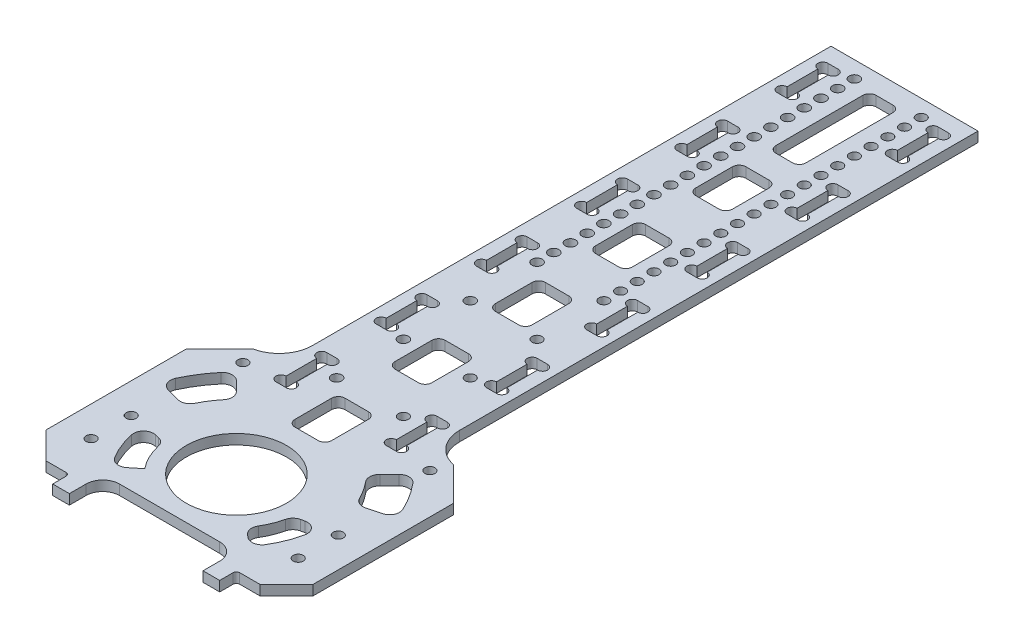
from build123d import *

# Parameters (mm, degrees)
EXTRUDE_1_DEPTH      = 3
SKETCH_2_W           = 18
SKETCH_2_H           = 165
CUT_EXTRUDE_1_DEPTH  = 127.29928273
CHAMFER_1_SIZE       = 10
FILLET_1_R           = 10
SKETCH_3_W           = 3.1
SKETCH_3_H           = 15.2
CUT_EXTRUDE_2_DEPTH  = 127.29928273
SKETCH_4_R           = 1.5
SKETCH_4_R_2         = 1.55
CUT_EXTRUDE_3_DEPTH  = 127.29928273
SKETCH_5_W           = 11
SKETCH_5_H           = 15
SKETCH_5_W_2         = 9
SKETCH_5_H_2         = 30
CUT_EXTRUDE_4_DEPTH  = 3
FILLET_2_R           = 2
SKETCH_6_R           = 15
CUT_EXTRUDE_5_DEPTH  = 3
CUT_EXTRUDE_6_DEPTH  = 127.29928273
FILLET_3_R           = 3
SKETCH_8_R           = 1.5
CUT_EXTRUDE_7_DEPTH  = 127.29928273
SKETCH_9_R           = 1.5
CUT_EXTRUDE_8_DEPTH  = 45
SKETCH_10_W          = 40
SKETCH_10_H          = 20
CUT_EXTRUDE_9_DEPTH  = 127.29928273
FILLET_4_R           = 5
FILLET_5_R           = 3
CHAMFER_2_SIZE       = 8
SKETCH_11_R          = 1.5
CUT_EXTRUDE_10_DEPTH = 10
FILLET_6_R           = 1


with BuildPart() as part:
    # 草图1 → 凸台-拉伸1 (new body)
    with BuildSketch(Plane(origin=(0, 0, 0), x_dir=(1, 0, 0), z_dir=(0, 1, 0))):
        Polygon((-20.072182136, -107), (-35.072182136, -107), (-35.072182136, 118), (44.927817864, 118), (44.927817864, -107), (29.927817864, -107), (29.927817864, -112), (-20.072182136, -112), align=None)
    extrude(amount=EXTRUDE_1_DEPTH)

    # 草图2 → 切除-拉伸1 (cut, through all)
    with BuildSketch(Plane(origin=(0, 3, 0), x_dir=(1, 0, 0), z_dir=(0, 1, 0))):
        with Locations((-26.072182136, 35.5)):
            Rectangle(SKETCH_2_W, SKETCH_2_H)
        with Locations((35.927817864, 35.5)):
            Rectangle(SKETCH_2_W, SKETCH_2_H)
    extrude(amount=-CUT_EXTRUDE_1_DEPTH, mode=Mode.SUBTRACT)

    # 倒角1
    chamfer_1_edges = [part.edges().sort_by_distance(p)[0] for p in [
        (-35.072182136, 1.5, 47),
        (44.927817864, 1.5, 47),
    ]]
    chamfer(chamfer_1_edges, length=CHAMFER_1_SIZE)

    # 圆角1
    # the kernel refuses this fillet: 10 mm, written as the material it adds along each edge
    with BuildSketch(Plane(origin=(-17.072182136, 3, 47), x_dir=(0, 0, -1), z_dir=(0, -1, 0))) as fillet_1_piece_1:
        with BuildLine():
            CenterArc((9.797958971, -10), FILLET_1_R, 90, 78.463040967)
            Line((0, -8), (-0.195959179, -7.96))
            ThreePointArc((-0.195959179, -7.96), (-0.2, -4), (-0.2, 0))
            Line((-0.2, 0), (0, 0.2))
            Line((0, 0.2), (9.797958971, 0.2))
            Line((9.797958971, 0.2), (9.797958971, 0))
        make_face()
    extrude(amount=3)
    with BuildSketch(Plane(origin=(26.927817864, 3, 47), x_dir=(1, 0, 0), z_dir=(0, -1, 0))) as fillet_1_piece_2:
        with BuildLine():
            CenterArc((10, -9.797958971), FILLET_1_R, 101.536959033, 78.463040967)
            Line((0, -9.797958971), (-0.2, -9.797958971))
            Line((-0.2, -9.797958971), (-0.2, 0))
            Line((-0.2, 0), (0, 0.2))
            ThreePointArc((0, 0.2), (4, 0.2), (7.96, 0.195959179))
            Line((7.96, 0.195959179), (8, 0))
        make_face()
    extrude(amount=3)

    # 草图3 → 切除-拉伸2 (cut, through all)
    with BuildSketch(Plane.XZ):
        with Locations((-11.572182136, -105.5)):
            Rectangle(SKETCH_3_W, SKETCH_3_H)
        with Locations((21.427817864, -105.5)):
            Rectangle(SKETCH_3_W, SKETCH_3_H)
        with Locations((-11.572182136, -75.5)):
            Rectangle(SKETCH_3_W, SKETCH_3_H)
        with Locations((21.427817864, -75.5)):
            Rectangle(SKETCH_3_W, SKETCH_3_H)
        with Locations((-11.572182136, -45.5)):
            Rectangle(SKETCH_3_W, SKETCH_3_H)
        with Locations((21.427817864, -45.5)):
            Rectangle(SKETCH_3_W, SKETCH_3_H)
        with Locations((-11.572182136, -15.5)):
            Rectangle(SKETCH_3_W, SKETCH_3_H)
        with Locations((21.427817864, -15.5)):
            Rectangle(SKETCH_3_W, SKETCH_3_H)
        with Locations((-11.572182136, 14.5)):
            Rectangle(SKETCH_3_W, SKETCH_3_H)
        with Locations((21.427817864, 14.5)):
            Rectangle(SKETCH_3_W, SKETCH_3_H)
        with Locations((-11.572182136, 44.5)):
            Rectangle(SKETCH_3_W, SKETCH_3_H)
        with Locations((21.427817864, 44.5)):
            Rectangle(SKETCH_3_W, SKETCH_3_H)
    extrude(amount=-CUT_EXTRUDE_2_DEPTH, mode=Mode.SUBTRACT)

    # 草图4 → 切除-拉伸3 (cut, through all)
    with BuildSketch(Plane(origin=(0, 3, 0), x_dir=(1, 0, 0), z_dir=(0, 1, 0))):
        with Locations(Location((14.927817864, 113, 0), (0, 0, 270))):
            Circle(SKETCH_4_R)
        with Locations(Location((-5.072182136, 113, 0), (0, 0, 90))):
            Circle(SKETCH_4_R_2)
        with Locations(Location((-5.072182136, 108, 0), (0, 0, 90))):
            Circle(SKETCH_4_R_2)
        with Locations(Location((14.927817864, 108, 0), (0, 0, 270))):
            Circle(SKETCH_4_R)
        with Locations(Location((-5.072182136, 103, 0), (0, 0, 90))):
            Circle(SKETCH_4_R_2)
        with Locations(Location((14.927817864, 103, 0), (0, 0, 270))):
            Circle(SKETCH_4_R)
        with Locations(Location((-5.072182136, 98, 0), (0, 0, 90))):
            Circle(SKETCH_4_R_2)
        with Locations(Location((14.927817864, 98, 0), (0, 0, 270))):
            Circle(SKETCH_4_R)
        with Locations(Location((-5.072182136, 93, 0), (0, 0, 90))):
            Circle(SKETCH_4_R_2)
        with Locations(Location((14.927817864, 93, 0), (0, 0, 270))):
            Circle(SKETCH_4_R)
        with Locations(Location((-5.072182136, 88, 0), (0, 0, 90))):
            Circle(SKETCH_4_R_2)
        with Locations(Location((14.927817864, 88, 0), (0, 0, 270))):
            Circle(SKETCH_4_R)
        with Locations(Location((-5.072182136, 83, 0), (0, 0, 90))):
            Circle(SKETCH_4_R_2)
        with Locations(Location((14.927817864, 83, 0), (0, 0, 270))):
            Circle(SKETCH_4_R)
        with Locations(Location((-5.072182136, 78, 0), (0, 0, 90))):
            Circle(SKETCH_4_R_2)
        with Locations(Location((14.927817864, 78, 0), (0, 0, 270))):
            Circle(SKETCH_4_R)
        with Locations(Location((-5.072182136, 73, 0), (0, 0, 90))):
            Circle(SKETCH_4_R_2)
        with Locations(Location((14.927817864, 73, 0), (0, 0, 270))):
            Circle(SKETCH_4_R)
        with Locations(Location((-5.072182136, 68, 0), (0, 0, 90))):
            Circle(SKETCH_4_R_2)
        with Locations(Location((14.927817864, 68, 0), (0, 0, 270))):
            Circle(SKETCH_4_R)
        with Locations(Location((-5.072182136, 63, 0), (0, 0, 90))):
            Circle(SKETCH_4_R_2)
        with Locations(Location((14.927817864, 63, 0), (0, 0, 270))):
            Circle(SKETCH_4_R)
        with Locations(Location((-5.072182136, 58, 0), (0, 0, 90))):
            Circle(SKETCH_4_R_2)
        with Locations(Location((14.927817864, 58, 0), (0, 0, 270))):
            Circle(SKETCH_4_R)
        with Locations(Location((-5.072182136, 53, 0), (0, 0, 90))):
            Circle(SKETCH_4_R_2)
        with Locations(Location((14.927817864, 53, 0), (0, 0, 270))):
            Circle(SKETCH_4_R)
        with Locations(Location((-5.072182136, 48, 0), (0, 0, 90))):
            Circle(SKETCH_4_R_2)
        with Locations(Location((14.927817864, 48, 0), (0, 0, 270))):
            Circle(SKETCH_4_R)
        with Locations(Location((-5.072182136, 43, 0), (0, 0, 90))):
            Circle(SKETCH_4_R_2)
        with Locations(Location((14.927817864, 43, 0), (0, 0, 270))):
            Circle(SKETCH_4_R)
        with Locations(Location((-5.072182136, 38, 0), (0, 0, 90))):
            Circle(SKETCH_4_R_2)
        with Locations(Location((14.927817864, 38, 0), (0, 0, 270))):
            Circle(SKETCH_4_R)
        with Locations(Location((-5.072182136, 33, 0), (0, 0, 90))):
            Circle(SKETCH_4_R_2)
        with Locations(Location((14.927817864, 33, 0), (0, 0, 270))):
            Circle(SKETCH_4_R)
        with Locations(Location((-5.072182136, 28, 0), (0, 0, 90))):
            Circle(SKETCH_4_R_2)
        with Locations(Location((14.927817864, 28, 0), (0, 0, 270))):
            Circle(SKETCH_4_R)
        with Locations(Location((-5.072182136, 23, 0), (0, 0, 90))):
            Circle(SKETCH_4_R_2)
        with Locations(Location((14.927817864, 23, 0), (0, 0, 270))):
            Circle(SKETCH_4_R)
        with Locations(Location((-5.072182136, 18, 0), (0, 0, 90))):
            Circle(SKETCH_4_R_2)
        with Locations(Location((14.927817864, 18, 0), (0, 0, 270))):
            Circle(SKETCH_4_R)
        with Locations(Location((-5.072182136, -2, 0), (0, 0, 90))):
            Circle(SKETCH_4_R_2)
        with Locations(Location((14.927817864, -2, 0), (0, 0, 270))):
            Circle(SKETCH_4_R)
        with Locations(Location((-5.072182136, -22, 0), (0, 0, 90))):
            Circle(SKETCH_4_R_2)
        with Locations(Location((14.927817864, -22, 0), (0, 0, 270))):
            Circle(SKETCH_4_R)
        with Locations(Location((-5.072182136, -42, 0), (0, 0, 90))):
            Circle(SKETCH_4_R_2)
        with Locations(Location((14.927817864, -42, 0), (0, 0, 270))):
            Circle(SKETCH_4_R)
        with Locations(Location((-23.072182136, -52.071067812, 0), (0, 0, 270))):
            Circle(SKETCH_4_R)
        with Locations(Location((32.927817864, -52.071067812, 0), (0, 0, 270))):
            Circle(SKETCH_4_R)
    extrude(amount=-CUT_EXTRUDE_3_DEPTH, mode=Mode.SUBTRACT)

    # 草图5 → 切除-拉伸4 (cut)
    with BuildSketch(Plane.XZ):
        with Locations((4.927817864, -36.5)):
            Rectangle(SKETCH_5_W, SKETCH_5_H)
        with Locations((4.927817864, -97)):
            Rectangle(SKETCH_5_W_2, SKETCH_5_H_2)
        with Locations((4.927817864, -66.5)):
            Rectangle(SKETCH_5_W, SKETCH_5_H)
        with Locations((4.927817864, -6.5)):
            Rectangle(SKETCH_5_W, SKETCH_5_H)
        with Locations((4.927817864, 23.5)):
            Rectangle(SKETCH_5_W, SKETCH_5_H)
        with Locations((4.927817864, 53.5)):
            Rectangle(SKETCH_5_W, SKETCH_5_H)
    extrude(amount=-CUT_EXTRUDE_4_DEPTH, mode=Mode.SUBTRACT)

    # 圆角2
    fillet_2_edges = [part.edges().sort_by_distance(p)[0] for p in [
        (0.427817864, 1.5, -112),
        (0.427817864, 1.5, -82),
        (9.427817864, 1.5, -82),
        (9.427817864, 1.5, -112),
        (-0.572182136, 1.5, -74),
        (-0.572182136, 1.5, -59),
        (10.427817864, 1.5, -59),
        (10.427817864, 1.5, -74),
        (10.427817864, 1.5, -44),
        (-0.572182136, 1.5, -44),
        (-0.572182136, 1.5, -29),
        (10.427817864, 1.5, -29),
        (10.427817864, 1.5, -14),
        (-0.572182136, 1.5, -14),
        (-0.572182136, 1.5, 1),
        (10.427817864, 1.5, 1),
        (10.427817864, 1.5, 16),
        (-0.572182136, 1.5, 16),
        (-0.572182136, 1.5, 31),
        (10.427817864, 1.5, 31),
        (10.427817864, 1.5, 46),
        (-0.572182136, 1.5, 46),
        (-0.572182136, 1.5, 61),
        (10.427817864, 1.5, 61),
    ]]
    fillet(fillet_2_edges, radius=FILLET_2_R)

    # 草图6 → 切除-拉伸5 (cut)
    with BuildSketch(Plane.XZ):
        with Locations(Location((4.927817864, 82, 0), (0, 0, 270))):
            Circle(SKETCH_6_R)
    extrude(amount=-CUT_EXTRUDE_5_DEPTH, mode=Mode.SUBTRACT)

    # 草图7 → 切除-拉伸6 (cut, through all)
    with BuildSketch(Plane(origin=(0, 3, 0), x_dir=(1, 0, 0), z_dir=(0, 1, 0))):
        with BuildLine():
            Line((24.373254346, -62.554563517), (31.444322158, -55.483495706))
            ThreePointArc((31.444322158, -55.483495706), (36.634268405, -61.976239262), (40.266427168, -69.452781487))
            Line((40.266427168, -69.452781487), (30.565487248, -72.052140504))
            ThreePointArc((30.565487248, -72.052140504), (27.964150055, -66.980765692), (24.373254346, -62.554563517))
        make_face()
        with BuildLine():
            Line((-14.517618619, -62.554563517), (-21.588686431, -55.483495706))
            ThreePointArc((-21.588686431, -55.483495706), (-26.778632677, -61.976239262), (-30.410791441, -69.452781487))
            Line((-30.410791441, -69.452781487), (-20.709851521, -72.052140504))
            ThreePointArc((-20.709851521, -72.052140504), (-18.108514327, -66.980765692), (-14.517618619, -62.554563517))
        make_face()
    extrude(amount=-CUT_EXTRUDE_6_DEPTH, mode=Mode.SUBTRACT)

    # 圆角3
    fillet_3_edges = [part.edges().sort_by_distance(p)[0] for p in [
        (31.444322158, 1.5, 55.483495706),
        (40.266427168, 1.5, 69.452781487),
        (30.565487248, 1.5, 72.052140504),
        (24.373254346, 1.5, 62.554563517),
        (-14.517618619, 1.5, 62.554563517),
        (-20.709851521, 1.5, 72.052140504),
        (-30.410791441, 1.5, 69.452781487),
        (-21.588686431, 1.5, 55.483495706),
    ]]
    fillet(fillet_3_edges, radius=FILLET_3_R)

    # 草图8 → 切除-拉伸7 (cut, through all)
    with BuildSketch(Plane(origin=(0, 3, 0), x_dir=(1, 0, 0), z_dir=(0, 1, 0))):
        with Locations(Location((-26.072182136, -94.5, 0), (0, 0, 270))):
            Circle(SKETCH_8_R)
        with Locations(Location((35.927817864, -94.5, 0), (0, 0, 90))):
            Circle(SKETCH_8_R)
    extrude(amount=-CUT_EXTRUDE_7_DEPTH, mode=Mode.SUBTRACT)

    # 草图9 → 切除-拉伸8 (cut, symmetric)
    with BuildSketch(Plane(origin=(-54.354252305, 3, 108.5), x_dir=(-1, 0, 0), z_dir=(0, -1, 0))):
        with Locations(Location((-90.282070169, 26, 0), (0, 0, 180))):
            Circle(SKETCH_9_R)
        with Locations(Location((-28.282070169, 26, 0), (0, 0, 180))):
            Circle(SKETCH_9_R)
    extrude(amount=CUT_EXTRUDE_8_DEPTH, both=True, mode=Mode.SUBTRACT)

    # 草图10 → 切除-拉伸9 (cut, through all)
    with BuildSketch(Plane.XZ):
        with Locations((4.927817864, 112)):
            Rectangle(SKETCH_10_W, SKETCH_10_H)
        with BuildLine():
            Line((20.095386546, 94.255401269), (25.540154791, 98.654776084))
            ThreePointArc((25.540154791, 98.654776084), (29.745634898, 91.291176333), (31.409831884, 82.976183092))
            Line((31.409831884, 82.976183092), (24.265490182, 84.510862268))
            ThreePointArc((24.265490182, 84.510862268), (22.855224932, 89.671901706), (20.095386546, 94.255401269))
        make_face()
        with BuildLine():
            Line((-14.409854454, 84.510862268), (-21.554196157, 82.976183092))
            ThreePointArc((-21.554196157, 82.976183092), (-19.889999171, 91.291176333), (-15.684519064, 98.654776084))
            Line((-15.684519064, 98.654776084), (-10.239750819, 94.255401269))
            ThreePointArc((-10.239750819, 94.255401269), (-12.999589205, 89.671901706), (-14.409854454, 84.510862268))
        make_face()
    extrude(amount=-CUT_EXTRUDE_9_DEPTH, mode=Mode.SUBTRACT)

    # 圆角4
    fillet_4_edges = [part.edges().sort_by_distance(p)[0] for p in [
        (-15.072182136, 1.5, 102),
        (24.927817864, 1.5, 102),
    ]]
    fillet(fillet_4_edges, radius=FILLET_4_R)

    # 圆角5
    fillet_5_edges = [part.edges().sort_by_distance(p)[0] for p in [
        (25.540154791, 1.5, 98.654776084),
        (31.409831884, 1.5, 82.976183092),
        (24.265490182, 1.5, 84.510862268),
        (20.095386546, 1.5, 94.255401269),
        (-14.409854454, 1.5, 84.510862268),
        (-21.554196157, 1.5, 82.976183092),
        (-15.684519064, 1.5, 98.654776084),
    ]]
    fillet(fillet_5_edges, radius=FILLET_5_R)

    # 倒角2
    chamfer_2_edges = [part.edges().sort_by_distance(p)[0] for p in [
        (-35.072182136, 1.5, 107),
        (44.927817864, 1.5, 107),
    ]]
    chamfer(chamfer_2_edges, length=CHAMFER_2_SIZE)

    # 草图11 → 切除-拉伸10 (cut)
    with BuildSketch(Plane.XZ):
        with Locations((22.977817864, -111.6)):
            Circle(SKETCH_11_R)
        with Locations((22.977817864, -99.4)):
            Circle(SKETCH_11_R)
        with Locations((22.977817864, -81.6)):
            Circle(SKETCH_11_R)
        with Locations((22.977817864, -69.4)):
            Circle(SKETCH_11_R)
        with Locations((22.977817864, -51.6)):
            Circle(SKETCH_11_R)
        with Locations((22.977817864, -39.4)):
            Circle(SKETCH_11_R)
        with Locations((22.977817864, -21.6)):
            Circle(SKETCH_11_R)
        with Locations((22.977817864, -9.4)):
            Circle(SKETCH_11_R)
        with Locations((22.977817864, 8.4)):
            Circle(SKETCH_11_R)
        with Locations((22.977817864, 20.6)):
            Circle(SKETCH_11_R)
        with Locations((22.977817864, 38.4)):
            Circle(SKETCH_11_R)
        with Locations((22.977817864, 50.6)):
            Circle(SKETCH_11_R)
        with Locations((19.877817864, 50.6)):
            Circle(SKETCH_11_R)
        with Locations((19.877817864, 38.4)):
            Circle(SKETCH_11_R)
        with Locations((19.877817864, 20.6)):
            Circle(SKETCH_11_R)
        with Locations((19.877817864, 8.4)):
            Circle(SKETCH_11_R)
        with Locations((19.877817864, -9.4)):
            Circle(SKETCH_11_R)
        with Locations((19.877817864, -21.6)):
            Circle(SKETCH_11_R)
        with Locations((19.877817864, -39.4)):
            Circle(SKETCH_11_R)
        with Locations((19.877817864, -51.6)):
            Circle(SKETCH_11_R)
        with Locations((19.877817864, -69.4)):
            Circle(SKETCH_11_R)
        with Locations((19.877817864, -81.6)):
            Circle(SKETCH_11_R)
        with Locations((19.877817864, -99.4)):
            Circle(SKETCH_11_R)
        with Locations((19.877817864, -111.6)):
            Circle(SKETCH_11_R)
        with Locations((-10.022182136, 8.4)):
            Circle(SKETCH_11_R)
        with Locations((-10.022182136, 20.6)):
            Circle(SKETCH_11_R)
        with Locations((-10.022182136, 38.4)):
            Circle(SKETCH_11_R)
        with Locations((-10.022182136, 50.6)):
            Circle(SKETCH_11_R)
        with Locations((-13.122182136, 50.6)):
            Circle(SKETCH_11_R)
        with Locations((-13.122182136, 38.4)):
            Circle(SKETCH_11_R)
        with Locations((-13.122182136, 20.6)):
            Circle(SKETCH_11_R)
        with Locations((-13.122182136, 8.4)):
            Circle(SKETCH_11_R)
        with Locations((-10.022182136, -21.6)):
            Circle(SKETCH_11_R)
        with Locations((-10.022182136, -9.4)):
            Circle(SKETCH_11_R)
        with Locations((-13.122182136, -9.4)):
            Circle(SKETCH_11_R)
        with Locations((-13.122182136, -21.6)):
            Circle(SKETCH_11_R)
        with Locations((-10.022182136, -51.6)):
            Circle(SKETCH_11_R)
        with Locations((-10.022182136, -39.4)):
            Circle(SKETCH_11_R)
        with Locations((-13.122182136, -39.4)):
            Circle(SKETCH_11_R)
        with Locations((-13.122182136, -51.6)):
            Circle(SKETCH_11_R)
        with Locations((-10.022182136, -81.6)):
            Circle(SKETCH_11_R)
        with Locations((-10.022182136, -69.4)):
            Circle(SKETCH_11_R)
        with Locations((-13.122182136, -69.4)):
            Circle(SKETCH_11_R)
        with Locations((-13.122182136, -81.6)):
            Circle(SKETCH_11_R)
        with Locations((-10.022182136, -99.4)):
            Circle(SKETCH_11_R)
        with Locations((-13.122182136, -99.4)):
            Circle(SKETCH_11_R)
        with Locations((-10.022182136, -111.6)):
            Circle(SKETCH_11_R)
        with Locations((-13.122182136, -111.6)):
            Circle(SKETCH_11_R)
    extrude(amount=-CUT_EXTRUDE_10_DEPTH, mode=Mode.SUBTRACT)

    # 圆角6
    fillet_6_edges = [part.edges().sort_by_distance(p)[0] for p in [
        (29.927817864, 1.5, 107),
        (-20.072182136, 1.5, 107),
    ]]
    fillet(fillet_6_edges, radius=FILLET_6_R)


solid = part.part
